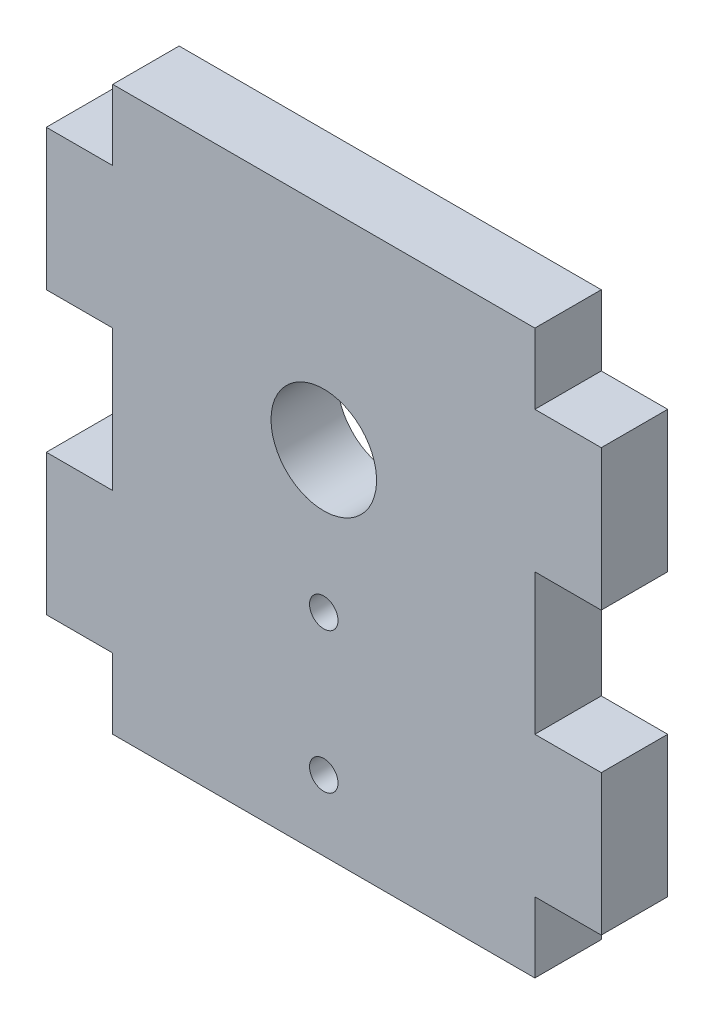
from build123d import *

# Parameters (mm, degrees)
BOSS_EXTRUDE1_DEPTH = 5.9944
SKETCH2_R           = 4.7625
CUT_EXTRUDE1_DEPTH  = 68.534353797
SKETCH3_R           = 1.286
CUT_EXTRUDE2_DEPTH  = 68.534353797


with BuildPart() as part:
    # Sketch1 → Boss-Extrude1 (new body)
    with BuildSketch(Plane.XY):
        Polygon((0, 0), (-38.1, 0), (-38.1, 6.35), (-44.0944, 6.35), (-44.0944, 19.05), (-38.1, 19.05), (-38.1, 31.75), (-44.0944, 31.75), (-44.0944, 44.45), (-38.1, 44.45), (-38.1, 50.8), (0, 50.8), (0, 44.45), (5.9944, 44.45), (5.9944, 31.75), (0, 31.75), (0, 19.05), (5.9944, 19.05), (5.9944, 6.35), (0, 6.35), align=None)
    extrude(amount=BOSS_EXTRUDE1_DEPTH)

    # Sketch2 → Cut-Extrude1 (cut, through all)
    with BuildSketch(Plane(origin=(0, 0, 0), x_dir=(-1, 0, 0), z_dir=(0, 0, -1))):
        with Locations((19.05, 31.75)):
            Circle(SKETCH2_R)
    extrude(amount=-CUT_EXTRUDE1_DEPTH, mode=Mode.SUBTRACT)

    # Sketch3 → Cut-Extrude2 (cut, through all)
    with BuildSketch(Plane.XY.offset(5.9944)):
        with Locations((-19.05, 19.05)):
            Circle(SKETCH3_R)
        with Locations((-19.05, 6.35)):
            Circle(SKETCH3_R)
    extrude(amount=-CUT_EXTRUDE2_DEPTH, mode=Mode.SUBTRACT)


solid = part.part
